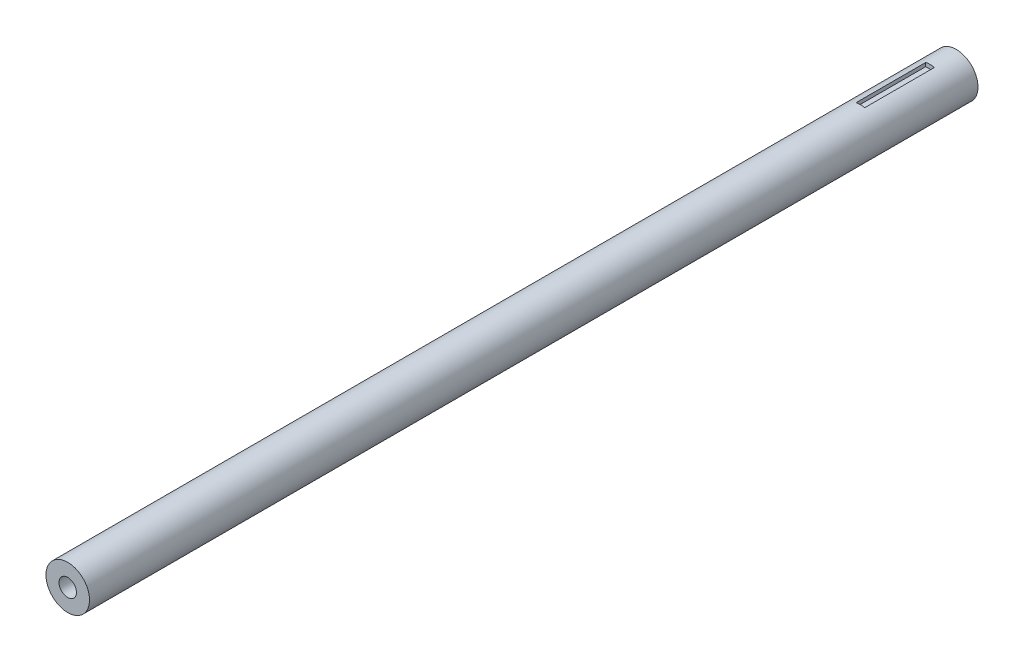
from build123d import *

# Parameters (mm, degrees)
EXTRUDE1_DEPTH      = 130.175
EXTRUDE1_DEPTH_BACK = 193.675
SKETCH1_R           = 7.9375
SKETCH2_R           = 3.175
CUT_EXTRUDE1_DEPTH  = 25.4
SKETCH3_W           = 25.4
SKETCH3_H           = 3.175
CUT_EXTRUDE2_DEPTH  = 1.5875


with BuildPart() as part:
    # Sketch1 → Extrude1 (new, two sides: drawn at the far end of the back side and taken through both)
    with BuildSketch(Plane.XY.offset(-EXTRUDE1_DEPTH_BACK)):
        Circle(SKETCH1_R)
    extrude(amount=EXTRUDE1_DEPTH + EXTRUDE1_DEPTH_BACK)

    # Sketch2 → Cut-Extrude1 (cut)
    with BuildSketch(Plane.XY.offset(130.175)):
        Circle(SKETCH2_R)
    extrude(amount=-CUT_EXTRUDE1_DEPTH, mode=Mode.SUBTRACT)

    # Sketch3 → Cut-Extrude2 (cut, symmetric)
    with BuildSketch(Plane(origin=(0, 0, 0), x_dir=(0, 0, -1), z_dir=(1, 0, 0))):
        with Locations((171.45, 8.0264)):
            Rectangle(SKETCH3_W, SKETCH3_H)
    extrude(amount=CUT_EXTRUDE2_DEPTH, both=True, mode=Mode.SUBTRACT)


solid = part.part
